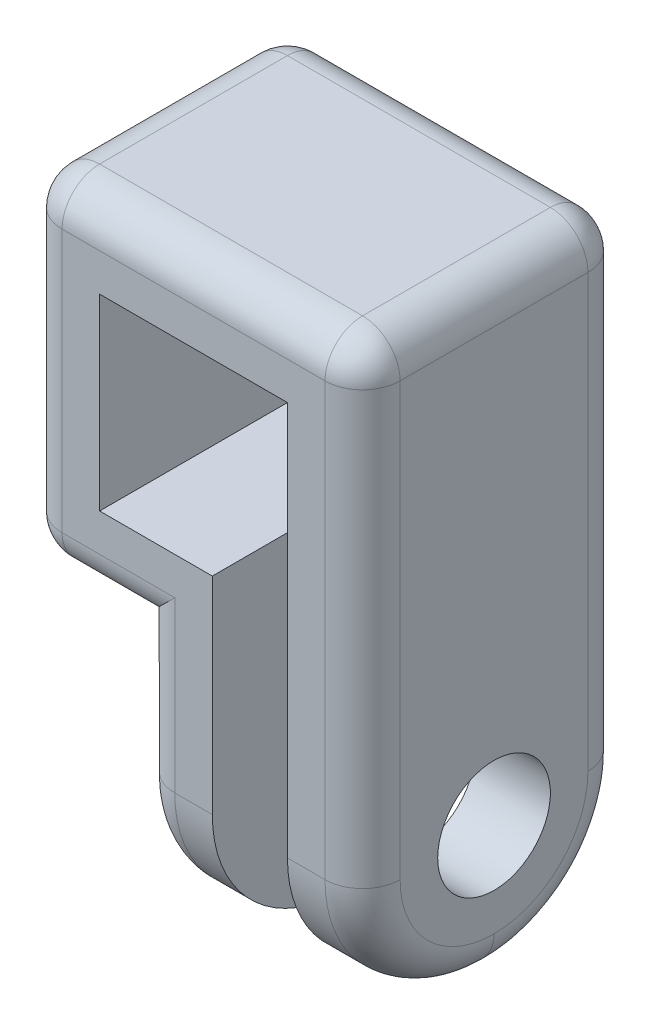
from build123d import *

# Parameters (mm, degrees)
SKETCH_1_W          = 2
SKETCH_1_H          = 7
EXTRUDE_2_DEPTH     = 7
FILLET_4_R          = 3.5
SKETCH_3_R          = 1.5
CUT_EXTRUDE_2_DEPTH = 15.739402973
FILLET_5_R          = 1


with BuildPart() as part:
    # 草图1 → 凸台-拉伸2 (new body)
    with BuildSketch(Plane.XY):
        Polygon((-2.5, -2.5), (-2.5, 2.5), (2.5, 2.5), (2.5, -2.5), (2.5, -4.5), (4.5, -4.5), (4.5, 4.5), (-4.5, 4.5), (-4.5, -4.5), (-1.5, -4.5), (0.5, -4.5), (0.5, -2.5), align=None)
        with Locations((-0.5, -8)):
            Rectangle(SKETCH_1_W, SKETCH_1_H)
        with Locations((3.5, -8)):
            Rectangle(SKETCH_1_W, SKETCH_1_H)
    extrude(amount=EXTRUDE_2_DEPTH)

    # 圆角4
    fillet_4_edges = [part.edges().sort_by_distance(p)[0] for p in [
        (3.5, -11.5, 0),
        (3.5, -11.5, 7),
        (-0.5, -11.5, 0),
        (-0.5, -11.5, 7),
    ]]
    fillet(fillet_4_edges, radius=FILLET_4_R - 0.0001)  # a hair under: the kernel refuses the full size

    # 草图3 → 切除-拉伸2 (cut, through all)
    with BuildSketch(Plane.ZY.offset(1.5)):
        with Locations((3.5, -8)):
            Circle(SKETCH_3_R)
    extrude(amount=-CUT_EXTRUDE_2_DEPTH, mode=Mode.SUBTRACT)

    # 圆角5
    fillet_5_edges = [part.edges().sort_by_distance(p)[0] for p in [
        (-4.5, 0, 0),
        (0, 4.5, 0),
        (4.5, -1.75005, 0),
        (-3, -4.5, 0),
        (-4.5, -4.5, 3.5),
        (-4.5, 4.5, 3.5),
        (4.5, 4.5, 3.5),
        (-3, -4.5, 7),
        (-1.5, -6.25005, 0),
        (4.5, -1.75005, 7),
        (4.5, -10.474903023, 5.974903023),
        (4.5, -10.474903023, 1.025096977),
        (-1.5, -6.25005, 7),
        (-1.5, -10.474903023, 5.974903023),
        (-1.5, -10.474903023, 1.025096977),
        (0, 4.5, 7),
        (-4.5, 0, 7),
    ]]
    fillet(fillet_5_edges, radius=FILLET_5_R)


solid = part.part
